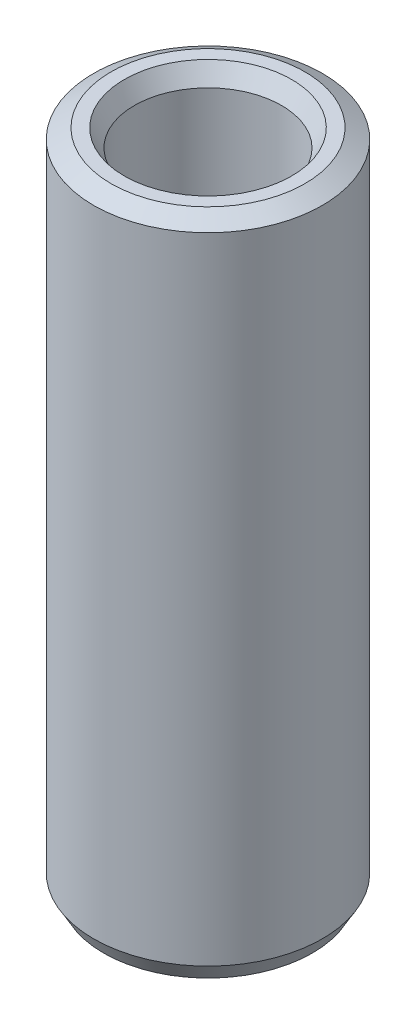
from build123d import *
from OCP.BRepFilletAPI import BRepFilletAPI_MakeChamfer

# Parameters (mm, degrees)
SKETCH1_R           = 45
BOSS_EXTRUDE1_DEPTH = 260.693337735
SKETCH2_R           = 28.946160356
CUT_EXTRUDE1_DEPTH  = 269.348684252
CHAMFER1_SIZE       = 3.967403432
CHAMFER1_SIZE2      = 6.871744318


with BuildPart() as part:
    # Sketch1 → Boss-Extrude1 (new body)
    with BuildSketch(Plane(origin=(0, 0, 0), x_dir=(1, 0, 0), z_dir=(0, 1, 0))):
        Circle(SKETCH1_R)
    extrude(amount=BOSS_EXTRUDE1_DEPTH)

    # Sketch2 → Cut-Extrude1 (cut, through all)
    with BuildSketch(Plane(origin=(0, 0, 0), x_dir=(1, 0, 0), z_dir=(0, 1, 0))):
        Circle(SKETCH2_R)
    extrude(amount=CUT_EXTRUDE1_DEPTH, mode=Mode.SUBTRACT)

    # Chamfer1: one chamfer whose edges measure the first distance from different faces: ONE call of the kernel's chamfer builder (chamfer() names one face for all edges)
    chamfer1_edges_1 = [part.edges().sort_by_distance(p)[0] for p in [
        (-28.946160356, 260.693337735, 0),
    ]]
    chamfer1_side_1 = [part.faces().sort_by_distance(p)[0] for p in [
        (-43.727207794, 260.693337735, 0),
    ]]
    chamfer1_edges_2 = [part.edges().sort_by_distance(p)[0] for p in [
        (-28.946160356, 0, 0),
    ]]
    chamfer1_side_2 = [part.faces().sort_by_distance(p)[0] for p in [
        (-28.946160356, 130.346668868, 0),
    ]]
    chamfer1_edges_3 = [part.edges().sort_by_distance(p)[0] for p in [
        (-45, 0, 0),
    ]]
    chamfer1_side_3 = [part.faces().sort_by_distance(p)[0] for p in [
        (-43.727207794, 0, 0),
    ]]
    chamfer1_edges_4 = [part.edges().sort_by_distance(p)[0] for p in [
        (-45, 260.693337735, 0),
    ]]
    chamfer1_side_4 = [part.faces().sort_by_distance(p)[0] for p in [
        (-45, 130.346668868, 0),
    ]]
    chamfer1 = BRepFilletAPI_MakeChamfer(part.part.solid().wrapped)
    for e in chamfer1_edges_1:
        chamfer1.Add(CHAMFER1_SIZE, CHAMFER1_SIZE2, e.wrapped, chamfer1_side_1[0].wrapped)  # the first distance lies on this face
    for e in chamfer1_edges_2:
        chamfer1.Add(CHAMFER1_SIZE, CHAMFER1_SIZE2, e.wrapped, chamfer1_side_2[0].wrapped)  # the first distance lies on this face
    for e in chamfer1_edges_3:
        chamfer1.Add(CHAMFER1_SIZE, CHAMFER1_SIZE2, e.wrapped, chamfer1_side_3[0].wrapped)  # the first distance lies on this face
    for e in chamfer1_edges_4:
        chamfer1.Add(CHAMFER1_SIZE, CHAMFER1_SIZE2, e.wrapped, chamfer1_side_4[0].wrapped)  # the first distance lies on this face
    add(Compound.cast(chamfer1.Shape()), mode=Mode.REPLACE)


solid = part.part
